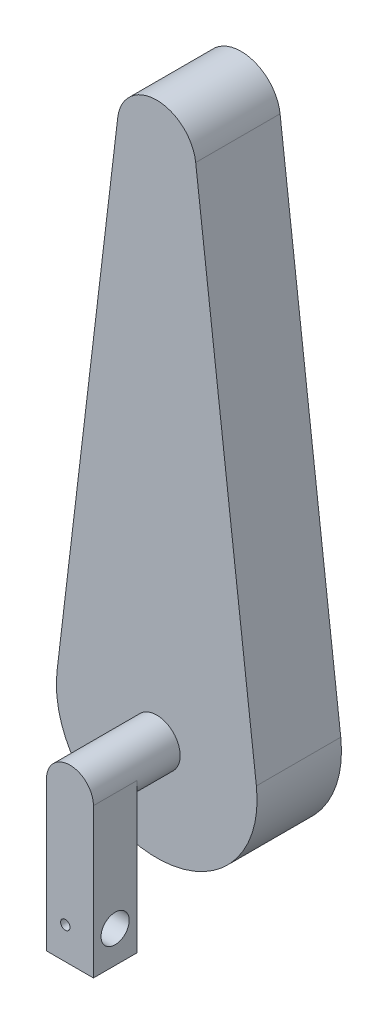
from build123d import *

# Parameters (mm, degrees)
BOSS_EXTRUDE1_DEPTH = 18
SKETCH2_R           = 5
BOSS_EXTRUDE2_DEPTH = 18.5
SKETCH3_W           = 10
SKETCH3_H           = 9.25
BOSS_EXTRUDE3_DEPTH = 35
DELETEFACE1_START   = 27.25
DELETEFACE1_DEPTH   = 9.25
SKETCH4_R           = 3
CUT_EXTRUDE1_DEPTH  = 124.902325662
SKETCH5_R           = 1
CUT_EXTRUDE4_DEPTH  = 123.576174145


# Read off the part's stored shape, not the designer's step: DeleteFace1
with BuildPart() as part:
    # Sketch1 → Boss-Extrude1 (new body)
    with BuildSketch(Plane(origin=(0, 0, 0), x_dir=(0, 1, 0), z_dir=(0, 0, 1))):
        with BuildLine():
            Line((-0.63860975, 30.836781145), (108.03933208, 17.892911363))
            ThreePointArc((108.03933208, 17.892911363), (115.421662674, 9.579146253), (108.03933208, 1.265381143))
            Line((108.03933208, 1.265381143), (-0.63860975, -11.678488639))
            ThreePointArc((-0.63860975, -11.678488639), (-24.578337326, 9.579146253), (-0.63860975, 30.836781145))
        make_face()
    extrude(amount=BOSS_EXTRUDE1_DEPTH)

    # Sketch2 → Boss-Extrude2 (add)
    with BuildSketch(Plane.XY.offset(18)):
        with Locations(Location((-9.579146253, -3.17045801, 0), (0, 0, 180))):
            Circle(SKETCH2_R)
    extrude(amount=BOSS_EXTRUDE2_DEPTH)

    # Sketch3 → Boss-Extrude3 (add)
    with BuildSketch(Plane(origin=(0, 0, 0), x_dir=(-1, 0, 0), z_dir=(0, 1, 0))):
        with Locations((9.579146253, 31.875)):
            Rectangle(SKETCH3_W, SKETCH3_H)
    extrude(amount=-BOSS_EXTRUDE3_DEPTH)

    # DeleteFace1 outline → DeleteFace1 (cut)
    with BuildSketch(Plane.XY.offset(DELETEFACE1_START)):
        with BuildLine():
            ThreePointArc((-5.712856558, 0), (-4.871097375, -1.486927267), (-4.579146253, -3.17045801))
            Line((-4.579146253, -3.17045801), (-4.579146253, 0))
            Line((-4.579146253, 0), (-5.712856558, 0))
        make_face()
        with BuildLine():
            Line((-14.579146253, 0), (-14.579146253, -3.17045801))
            ThreePointArc((-14.579146253, -3.17045801), (-14.287195131, -1.486927267), (-13.445435948, 0))
            Line((-13.445435948, 0), (-14.579146253, 0))
        make_face()
    extrude(amount=DELETEFACE1_DEPTH, mode=Mode.SUBTRACT)

    # Sketch4 → Cut-Extrude1 (cut, through all)
    with BuildSketch(Plane.YZ.offset(-4.579146253)):
        with Locations(Location((-28.17045801, 31.875, 0), (0, 0, 270))):
            Circle(SKETCH4_R)
    extrude(amount=-CUT_EXTRUDE1_DEPTH, mode=Mode.SUBTRACT)

    # Sketch5 → Cut-Extrude4 (cut, through all)
    with BuildSketch(Plane(origin=(0, 0, 27.25), x_dir=(1, 0, 0), z_dir=(0, 0, -1))):
        with Locations(Location((-10.579146253, 28.17045801, 0), (0, 0, 180))):
            Circle(SKETCH5_R)
    extrude(amount=-CUT_EXTRUDE4_DEPTH, mode=Mode.SUBTRACT)


solid = part.part
